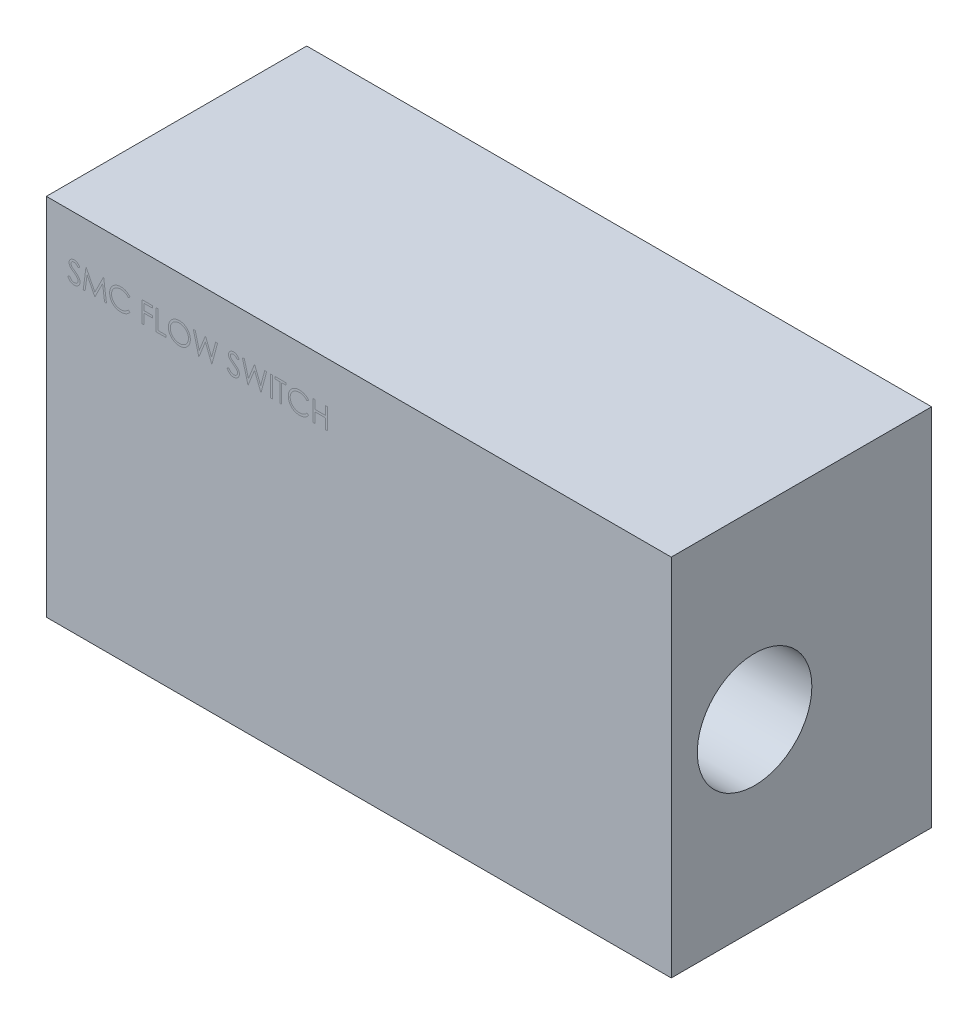
from build123d import *

# Parameters (mm, degrees)
SKETCH1_W                 = 60
SKETCH1_H                 = 35
BOSS_EXTRUDE1_DEPTH       = 12.5
M10_CLEARANCE_HOLE1_D     = 11
M10_CLEARANCE_HOLE1_DEPTH = 8
M10_CLEARANCE_HOLE1_TIP   = 3.304733405


with BuildPart() as part:
    # Sketch1 → Boss-Extrude1 (new, symmetric)
    with BuildSketch(Plane.XY):
        Rectangle(SKETCH1_W, SKETCH1_H)
    extrude(amount=BOSS_EXTRUDE1_DEPTH, both=True)

    # M10 Clearance Hole1
    with Locations(Plane(origin=(30, 0, 0), x_dir=(0, 0, -1), z_dir=(1, 0, 0))):
        with Locations((-4.5, 0)):
            Hole(M10_CLEARANCE_HOLE1_D / 2, depth=M10_CLEARANCE_HOLE1_DEPTH)
            with Locations((0, 0, -(M10_CLEARANCE_HOLE1_DEPTH + M10_CLEARANCE_HOLE1_TIP / 2))):  # 118° drill point
                Cone(0, M10_CLEARANCE_HOLE1_D / 2, M10_CLEARANCE_HOLE1_TIP, mode=Mode.SUBTRACT)


solid = part.part
